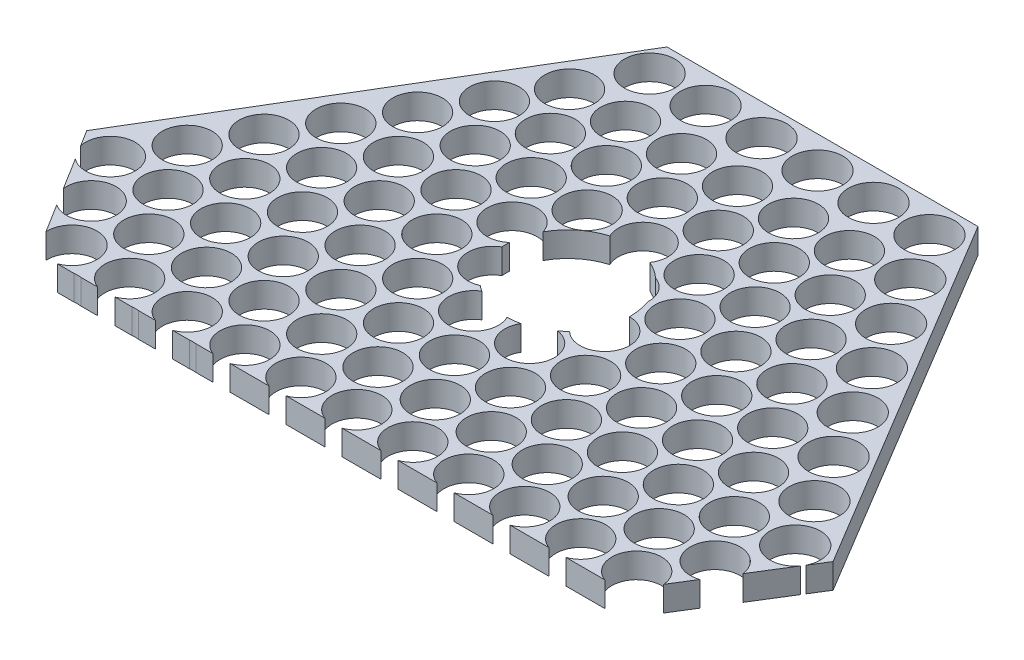
from build123d import *

# Parameters (mm, degrees)
BOSS_EXTRUDE1_DEPTH  = 2
SKETCH2_R            = 2.028178019
CUT_EXTRUDE1_DEPTH   = 2
LPATTERN1_COUNT      = 6
LPATTERN1_PITCH      = 4.5
LPATTERN2_COUNT      = 8
LPATTERN2_PITCH      = 4.5
SKETCH4_R            = 2
CUT_EXTRUDE3_DEPTH   = 2
LPATTERN4_COUNT      = 8
LPATTERN4_PITCH      = 4.5
LPATTERN4_COUNT_DIR2 = 6
LPATTERN4_PITCH_DIR2 = 4.5
SKETCH5_R            = 2
CUT_EXTRUDE4_DEPTH   = 2
LPATTERN5_COUNT      = 6
LPATTERN5_PITCH      = 4.5
LPATTERN5_COUNT_DIR2 = 6
LPATTERN5_PITCH_DIR2 = 4.5
SKETCH6_W            = 0.774823081
SKETCH6_H            = 1.866619241
CUT_EXTRUDE5_DEPTH   = 3
SKETCH7_R            = 2
CUT_EXTRUDE6_DEPTH   = 3
LPATTERN6_DEPTH      = 2
LPATTERN7_COUNT      = 2
LPATTERN7_PITCH      = 4.5
SKETCH8_R            = 5
CUT_EXTRUDE7_DEPTH   = 10


# Read off the part's stored shape, not the designer's step: LPattern6
with BuildPart() as part:
    # Sketch1 → Boss-Extrude1 (new body)
    with BuildSketch(Plane(origin=(0, 0, 0), x_dir=(1, 0, 0), z_dir=(0, 1, 0))):
        Polygon((-12.273533446, 20.252933108), (12.726466554, 20.252933108), (30.226466554, -8.897066892), (23.726466554, -19.347066892), (-23.273533446, -19.347066892), (-29.773533446, -8.897066892), align=None)
    extrude(amount=BOSS_EXTRUDE1_DEPTH)

    # Sketch2 → Cut-Extrude1 (cut)
    with BuildSketch(Plane(origin=(0, 2, 0), x_dir=(1, 0, 0), z_dir=(0, 1, 0))):
        with Locations(Location((11.377256113, 17.701051842, 0), (0, 0, 270))):
            Circle(SKETCH2_R)
    cut_extrude1 = extrude(amount=-CUT_EXTRUDE1_DEPTH, mode=Mode.SUBTRACT)

    # LPattern1: Cut-Extrude1 ×6
    with Locations(*[(-i * LPATTERN1_PITCH, 0, 0) for i in range(1, LPATTERN1_COUNT)]):
        add(cut_extrude1, mode=Mode.SUBTRACT)

    # LPattern2: Cut-Extrude1 ×8
    with Locations(*[Vector(0.5147120046125901, 0, 0.8573631391118288) * (i * LPATTERN2_PITCH) for i in range(1, LPATTERN2_COUNT)]):
        add(cut_extrude1, mode=Mode.SUBTRACT)

    # Sketch4 → Cut-Extrude3 (cut)
    with BuildSketch(Plane(origin=(0, 2, 0), x_dir=(1, 0, 0), z_dir=(0, 1, 0))):
        with Locations(Location((9.248601258, 13.393901657, 0), (0, 0, 270))):
            Circle(SKETCH4_R)
    cut_extrude3 = extrude(amount=-CUT_EXTRUDE3_DEPTH, mode=Mode.SUBTRACT)

    # LPattern4: Cut-Extrude3 8 × 6
    with Locations(*[Vector(0.5147120046125901, 0, 0.8573631391118288) * (i * LPATTERN4_PITCH) + Vector(-1, 0, 0) * (j * LPATTERN4_PITCH_DIR2) for i in range(LPATTERN4_COUNT) for j in range(LPATTERN4_COUNT_DIR2) if (i, j) != (0, 0)]):
        add(cut_extrude3, mode=Mode.SUBTRACT)

    # Sketch5 → Cut-Extrude4 (cut)
    with BuildSketch(Plane(origin=(0, 2, 0), x_dir=(1, 0, 0), z_dir=(0, 1, 0))):
        with Locations(Location((-15.435194721, 9.535767531, 0), (0, 0, 270))):
            Circle(SKETCH5_R)
    cut_extrude4 = extrude(amount=-CUT_EXTRUDE4_DEPTH, mode=Mode.SUBTRACT)

    # LPattern5: Cut-Extrude4 6 × 6
    with Locations(*[Vector(-0.5147120046125901, 0, 0.8573631391118288) * (i * LPATTERN5_PITCH) + Vector(0.5147120046125901, 0, 0.8573631391118288) * (j * LPATTERN5_PITCH_DIR2) for i in range(LPATTERN5_COUNT) for j in range(LPATTERN5_COUNT_DIR2) if (i, j) != (0, 0)]):
        add(cut_extrude4, mode=Mode.SUBTRACT)

    # Sketch6 → Cut-Extrude5 (cut)
    with BuildSketch(Plane(origin=(0, 2, 0), x_dir=(1, 0, 0), z_dir=(0, 1, 0))):
        with Locations((-23.405230337, -19.594174878)):
            Rectangle(SKETCH6_W, SKETCH6_H)
    extrude(amount=-CUT_EXTRUDE5_DEPTH, mode=Mode.SUBTRACT)

    # Sketch7 → Cut-Extrude6 (cut)
    with BuildSketch(Plane(origin=(0, 2, 0), x_dir=(1, 0, 0), z_dir=(0, 1, 0))):
        with Locations((-3.986582659, -17.471171351)):
            Circle(SKETCH7_R)
    cut_extrude6 = extrude(amount=-CUT_EXTRUDE6_DEPTH, mode=Mode.SUBTRACT)

    # LPattern6 outline → LPattern6 (cut)
    with BuildSketch(Plane(origin=(0, 0, 0), x_dir=(1, 0, 0), z_dir=(0, 1, 0))):
        with BuildLine():
            Line((-0.180135771, -19.347066892), (1.206970453, -19.347066892))
            ThreePointArc((1.206970453, -19.347066892), (0.513417341, -15.471171351), (-0.180135771, -19.347066892))
        make_face()
        with BuildLine():
            ThreePointArc((25.00529483, -17.291104509), (21.79762259, -15.883140142), (22.319864229, -19.347066892))
            Line((22.319864229, -19.347066892), (23.726466554, -19.347066892))
            Line((23.726466554, -19.347066892), (25.00529483, -17.291104509))
        make_face()
        with BuildLine():
            ThreePointArc((19.206970453, -19.347066892), (18.513417341, -15.471171351), (17.819864229, -19.347066892))
            Line((17.819864229, -19.347066892), (19.206970453, -19.347066892))
        make_face()
        with BuildLine():
            ThreePointArc((14.706970453, -19.347066892), (14.013417341, -15.471171351), (13.319864229, -19.347066892))
            Line((13.319864229, -19.347066892), (14.706970453, -19.347066892))
        make_face()
        with BuildLine():
            ThreePointArc((10.206970453, -19.347066892), (9.513417341, -15.471171351), (8.819864229, -19.347066892))
            Line((8.819864229, -19.347066892), (10.206970453, -19.347066892))
        make_face()
        with BuildLine():
            ThreePointArc((5.706970453, -19.347066892), (5.013417341, -15.471171351), (4.319864229, -19.347066892))
            Line((4.319864229, -19.347066892), (5.706970453, -19.347066892))
        make_face()
    extrude(amount=LPATTERN6_DEPTH, mode=Mode.SUBTRACT)

    # LPattern7: Cut-Extrude6 ×2
    with Locations(*[Vector(0.5281717070926116, 0, -0.8491375906335066) * (i * LPATTERN7_PITCH) for i in range(1, LPATTERN7_COUNT)]):
        add(cut_extrude6, mode=Mode.SUBTRACT)

    # Sketch8 → Cut-Extrude7 (cut)
    with BuildSketch(Plane(origin=(0, 2, 0), x_dir=(1, 0, 0), z_dir=(0, 1, 0))):
        Circle(SKETCH8_R)
    extrude(amount=-CUT_EXTRUDE7_DEPTH, mode=Mode.SUBTRACT)


solid = part.part
